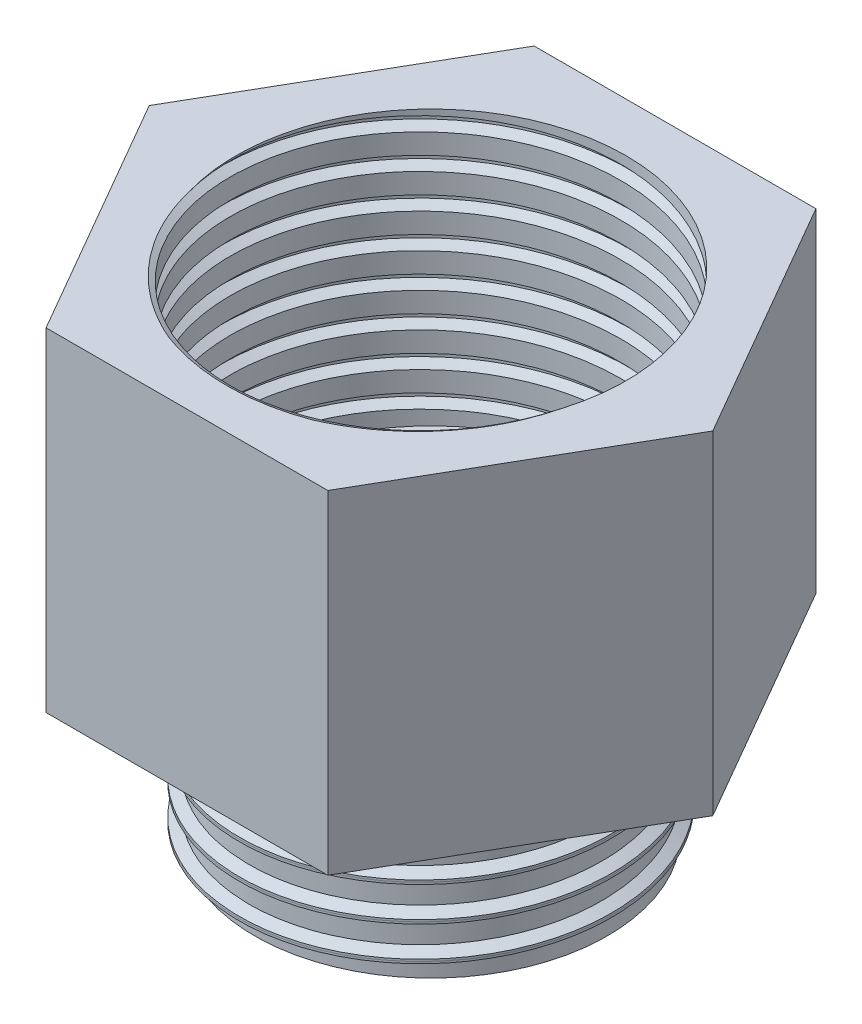
from build123d import *

# Parameters (mm, degrees)
BASE_CAP_R           = 9
BASE_CAP_R_2         = 5
BOTTOM_RIM_DEPTH     = 8
BASE_HEX_INNER_R     = 9.95
HEX_EXTRUDE_DEPTH    = 17
OUTSIDE_PITCH        = 1.75
INER_START           = 3
BASE_HEX_INNER_6_R   = 9.95
BASE_HEX_INNER_6_R_2 = 5
INER_DEPTH           = 3
CUT_SWEEP2_PITCH     = 1.75
CUT_SWEEP2_TO        = 14


with BuildPart() as part:
    # base-cap → bottom-rim (new body)
    with BuildSketch(Plane(origin=(0, 0, 0), x_dir=(1, 0, 0), z_dir=(0, 1, 0))):
        with Locations(Location((0, 0, 0), (0, 0, 270))):
            Circle(BASE_CAP_R)
        with Locations(Location((0, 0, 0), (0, 0, 270))):
            Circle(BASE_CAP_R_2, mode=Mode.SUBTRACT)
    extrude(amount=-BOTTOM_RIM_DEPTH)

    # outside: arcs per turn and ends read off the stored shape
    # outside: the profile of extrude out profile screwed along a right-hand helix through 4.5 turns, 10 arcs to a turn; built about Z, then put on its axis
    outside_z = Axis((0, 0, 0), (0, 0, 1))
    outside_corners = [(9.5, 0, 0), (9.5, 0, -0.099212832), (8.9997, 0, -0.388061172), (8.9997, 0, 0.388061172), (9.5, 0, 0.099212832)]
    with BuildLine(mode=Mode.PRIVATE) as outside_profile:
        Line(outside_corners[0], outside_corners[1])
        Line(outside_corners[1], outside_corners[2])
        Line(outside_corners[2], outside_corners[3])
        Line(outside_corners[3], outside_corners[4])
        Line(outside_corners[4], outside_corners[0])
    outside_cap = Face(outside_profile.wire())
    outside_turn_angles = [0, 18, 36, 54, 72, 90, 108, 126, 144, 162, 180, 198, 216, 234, 252, 270, 288, 306, 324, 342, 360]
    outside_turn_weights = [1, 0.9510565162951535, 1, 0.9510565162951535, 1, 0.9510565162951535, 1, 0.9510565162951535, 1, 0.9510565162951535, 1, 0.9510565162951535, 1, 0.9510565162951535, 1, 0.9510565162951535, 1, 0.9510565162951535, 1, 0.9510565162951535, 1]
    outside_turn_rails = [Edge.make_bspline([Vector(p[0], p[1], 0).rotate(outside_z, outside_turn_angles[k]) / outside_turn_weights[k] + Vector(0, 0, p[2] + OUTSIDE_PITCH * outside_turn_angles[k] / 360) for k in range(21)], [0, 0, 0, 1, 1, 2, 2, 3, 3, 4, 4, 5, 5, 6, 6, 7, 7, 8, 8, 9, 9, 10, 10, 10], 2, outside_turn_weights) for p in outside_corners]
    outside_turn_sides = [Face.make_surface_from_curves(outside_turn_rails[p[0]], outside_turn_rails[p[1]]) for p in [(0, 1), (1, 2), (2, 3), (3, 4), (4, 0)]]
    outside_last_angles = [1440, 1458, 1476, 1494, 1512, 1530, 1548, 1566, 1584, 1602, 1620]
    outside_last_weights = [1, 0.9510565162951535, 1, 0.9510565162951535, 1, 0.9510565162951535, 1, 0.9510565162951535, 1, 0.9510565162951499, 1]
    outside_last_rails = [Edge.make_bspline([Vector(p[0], p[1], 0).rotate(outside_z, outside_last_angles[k]) / outside_last_weights[k] + Vector(0, 0, p[2] + OUTSIDE_PITCH * outside_last_angles[k] / 360) for k in range(11)], [0, 0, 0, 1, 1, 2, 2, 3, 3, 4, 4, 5, 5, 5], 2, outside_last_weights) for p in outside_corners]
    outside_last_sides = [Face.make_surface_from_curves(outside_last_rails[p[0]], outside_last_rails[p[1]]) for p in [(0, 1), (1, 2), (2, 3), (3, 4), (4, 0)]]
    outside = Plane(origin=(0, -8, 0), x_dir=(0, 0, -1), z_dir=(0, 1, 0)) * Solid(Shell([*[p.moved(Location((0, 0, OUTSIDE_PITCH * i))) for i in range(4) for p in outside_turn_sides], *outside_last_sides, outside_cap, outside_cap.rotate(outside_z, 1620).moved(Location((0, 0, OUTSIDE_PITCH * 1620 / 360)))]))
    add(outside)



with BuildPart() as body_2:
    # base-hex-inner → hex-extrude (new body)
    with BuildSketch(Plane(origin=(0, 0, 0), x_dir=(1, 0, 0), z_dir=(0, 1, 0))):
        Polygon((-7.188010851, -12.45), (7.188010851, -12.45), (14.376021703, 0), (7.188010851, 12.45), (-7.188010851, 12.45), (-14.376021703, 0), align=None)
        with Locations(Location((0, 0, 0), (0, 0, 270))):
            Circle(BASE_HEX_INNER_R, mode=Mode.SUBTRACT)
    extrude(amount=HEX_EXTRUDE_DEPTH)


with BuildPart() as part_1:
    add(part.part)

    add(body_2.part)  # iner merges body 2
    # base-hex-inner<6> → iner (add)
    with BuildSketch(Plane(origin=(0, 0, 0), x_dir=(1, 0, 0), z_dir=(0, 1, 0)).offset(INER_START)):
        with Locations(Location((0, 0, 0), (0, 0, 270))):
            Circle(BASE_HEX_INNER_6_R)
        with Locations(Location((0, 0, 0), (0, 0, 270))):
            Circle(BASE_HEX_INNER_6_R_2, mode=Mode.SUBTRACT)
    extrude(amount=-INER_DEPTH)

    # Cut-Sweep2: arcs per turn and ends read off the stored shape
    # Cut-Sweep2: the profile of cut screwed along a right-hand helix through 9.6 turns, 10 arcs to a turn; built about Z, then put on its axis
    cut_sweep2_z = Axis((0, 0, 0), (0, 0, 1))
    cut_sweep2_corners = [(9.703589838, 0, -1.75), (9.703589838, 0, -2.25), (10.396410162, 0, -1.85), (10.396410162, 0, -1.65), (9.703589838, 0, -1.25)]
    with BuildLine(mode=Mode.PRIVATE) as cut_sweep2_profile:
        Line(cut_sweep2_corners[0], cut_sweep2_corners[1])
        Line(cut_sweep2_corners[1], cut_sweep2_corners[2])
        Line(cut_sweep2_corners[2], cut_sweep2_corners[3])
        Line(cut_sweep2_corners[3], cut_sweep2_corners[4])
        Line(cut_sweep2_corners[4], cut_sweep2_corners[0])
    cut_sweep2_cap = Face(cut_sweep2_profile.wire())
    cut_sweep2_turn_angles = [0, 18, 36, 54, 72, 90, 108, 126, 144, 162, 180, 198, 216, 234, 252, 270, 288, 306, 324, 342, 360]
    cut_sweep2_turn_weights = [1, 0.9510565162951535, 1, 0.9510565162951535, 1, 0.9510565162951535, 1, 0.9510565162951535, 1, 0.9510565162951535, 1, 0.9510565162951535, 1, 0.9510565162951535, 1, 0.9510565162951535, 1, 0.9510565162951535, 1, 0.9510565162951535, 1]
    cut_sweep2_turn_rails = [Edge.make_bspline([Vector(p[0], p[1], 0).rotate(cut_sweep2_z, cut_sweep2_turn_angles[k]) / cut_sweep2_turn_weights[k] + Vector(0, 0, p[2] + CUT_SWEEP2_PITCH * cut_sweep2_turn_angles[k] / 360) for k in range(21)], [0, 0, 0, 1, 1, 2, 2, 3, 3, 4, 4, 5, 5, 6, 6, 7, 7, 8, 8, 9, 9, 10, 10, 10], 2, cut_sweep2_turn_weights) for p in cut_sweep2_corners]
    cut_sweep2_turn_sides = [Face.make_surface_from_curves(cut_sweep2_turn_rails[p[0]], cut_sweep2_turn_rails[p[1]]) for p in [(0, 1), (1, 2), (2, 3), (3, 4), (4, 0)]]
    cut_sweep2_last_angles = [3240, 3258, 3276, 3294, 3312, 3330, 3348, 3366, 3384, 3402, 3420, 3438, 3456]
    cut_sweep2_last_weights = [1, 0.9510565162951535, 1, 0.9510565162951535, 1, 0.9510565162951535, 1, 0.9510565162951535, 1, 0.9510565162951535, 1, 0.9510565162951535, 1]
    cut_sweep2_last_rails = [Edge.make_bspline([Vector(p[0], p[1], 0).rotate(cut_sweep2_z, cut_sweep2_last_angles[k]) / cut_sweep2_last_weights[k] + Vector(0, 0, p[2] + CUT_SWEEP2_PITCH * cut_sweep2_last_angles[k] / 360) for k in range(13)], [0, 0, 0, 1, 1, 2, 2, 3, 3, 4, 4, 5, 5, 6, 6, 6], 2, cut_sweep2_last_weights) for p in cut_sweep2_corners]
    cut_sweep2_last_sides = [Face.make_surface_from_curves(cut_sweep2_last_rails[p[0]], cut_sweep2_last_rails[p[1]]) for p in [(0, 1), (1, 2), (2, 3), (3, 4), (4, 0)]]
    cut_sweep2 = Plane(origin=(0, 17, 0), x_dir=(0, 0, 1), z_dir=(0, -1, 0)) * split(Solid(Shell([*[p.moved(Location((0, 0, CUT_SWEEP2_PITCH * i))) for i in range(9) for p in cut_sweep2_turn_sides], *cut_sweep2_last_sides, cut_sweep2_cap, cut_sweep2_cap.rotate(cut_sweep2_z, 3456).moved(Location((0, 0, CUT_SWEEP2_PITCH * 3456 / 360)))])), bisect_by=Plane.XY.offset(CUT_SWEEP2_TO), keep=Keep.BOTTOM, mode=Mode.PRIVATE)
    add(cut_sweep2, mode=Mode.SUBTRACT)


solid = part_1.part
